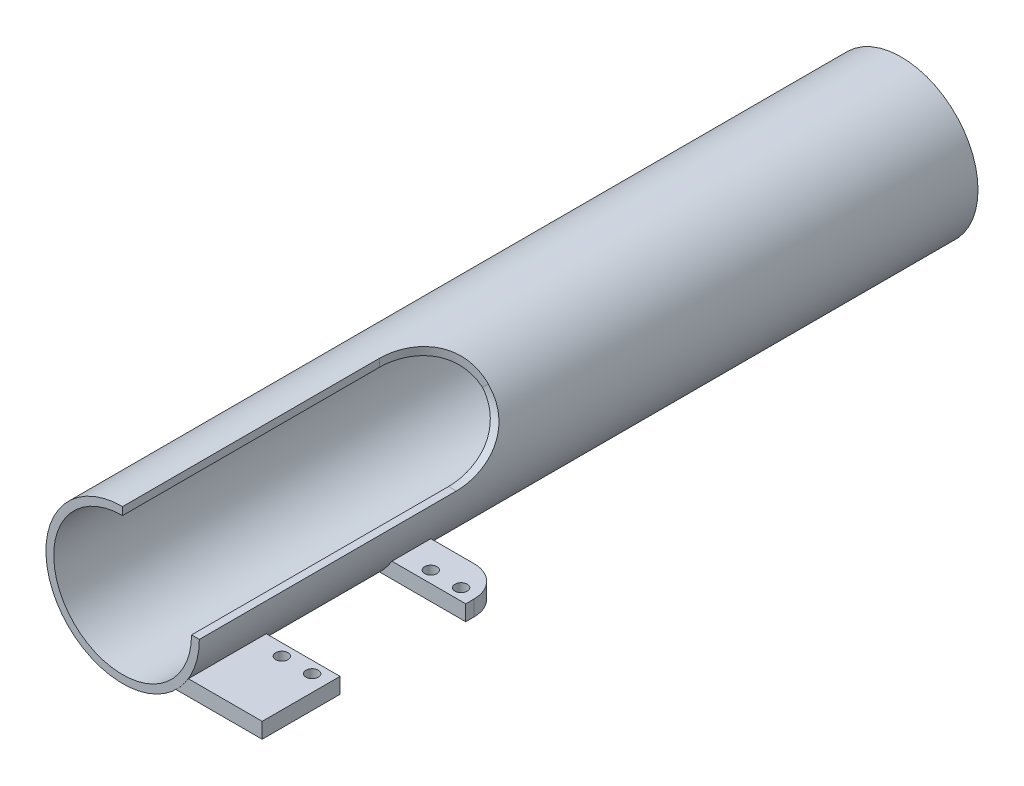
from build123d import *

# Parameters (mm, degrees)
SKETCH1_R                            = 25.019
SKETCH1_R_2                          = 22.479
BOSS_EXTRUDE1_DEPTH                  = 254
CUT_EXTRUDE1_DEPTH                   = 101.6
SKETCH3_W                            = 25.4
SKETCH3_H                            = 5.08
SKETCH3_W_2                          = 12.7
BOSS_EXTRUDE2_DEPTH                  = 20.5
BOSS_EXTRUDE2_DIRECTION_2_REACH      = 262.088
BOSS_EXTRUDE2_DIRECTION_2_END_RADIUS = 25.019
FILLET3_R                            = 17.78
SKETCH4_R                            = 2
CUT_EXTRUDE2_DEPTH                   = 5.08
FILLET4_R                            = 10


with BuildPart() as part:
    # Sketch1 → Boss-Extrude1 (new body)
    with BuildSketch(Plane.XY):
        Circle(SKETCH1_R)
        Circle(SKETCH1_R_2, mode=Mode.SUBTRACT)
    extrude(amount=-BOSS_EXTRUDE1_DEPTH)

    # Sketch2 → Cut-Extrude1 (cut)
    with BuildSketch(Plane.XY):
        with BuildLine():
            Line((0, 22.479), (0, 25.019))
            ThreePointArc((0, 25.019), (17.691104559, 17.691104559), (25.019, 0))
            Line((25.019, 0), (22.479, 0))
            ThreePointArc((22.479, 0), (15.895053334, 15.895053334), (0, 22.479))
        make_face()
    extrude(amount=-CUT_EXTRUDE1_DEPTH, mode=Mode.SUBTRACT)

    # Fillet3
    # the kernel refuses this fillet: 17.78 mm, written as the material it adds along each edge
    with BuildSketch(Plane(origin=(69.469, 0, -101.6), x_dir=(0, 0, 1), z_dir=(-1, 0, 0))) as fillet3_piece_1_section:
        with BuildLine():
            CenterArc((FILLET3_R, FILLET3_R), FILLET3_R, 180, 90)
            Line((0, FILLET3_R), (0, 0))
            Line((0, 0), (FILLET3_R, 0))
        make_face()
    fillet3_piece_1 = extrude(amount=91.44, mode=Mode.PRIVATE)
    fillet3_piece_1 = fillet3_piece_1 & Plane(origin=(0, 0, -97.674052769), x_dir=(1, 0, 0), z_dir=(0, 0, 1)) * Cylinder(25.019, 254, mode=Mode.PRIVATE)
    fillet3_piece_1 = fillet3_piece_1 - Plane(origin=(0, 0, -97.674052769), x_dir=(1, 0, 0), z_dir=(0, 0, 1)) * Cylinder(22.479, 254, mode=Mode.PRIVATE)
    add(fillet3_piece_1)
    with BuildSketch(Plane(origin=(0, -21.971, -101.6), x_dir=(1, 0, 0), z_dir=(0, 1, 0))) as fillet3_piece_2_section:
        with BuildLine():
            CenterArc((FILLET3_R, -FILLET3_R), FILLET3_R, 90, 90)
            Line((0, -FILLET3_R), (0, 0))
            Line((0, 0), (FILLET3_R, 0))
        make_face()
    fillet3_piece_2 = extrude(amount=91.44, mode=Mode.PRIVATE)
    fillet3_piece_2 = fillet3_piece_2 & Plane(origin=(0, 0, -100.962112939), x_dir=(1, 0, 0), z_dir=(0, 0, 1)) * Cylinder(25.019, 254, mode=Mode.PRIVATE)
    fillet3_piece_2 = fillet3_piece_2 - Plane(origin=(0, 0, -100.962112939), x_dir=(1, 0, 0), z_dir=(0, 0, 1)) * Cylinder(22.479, 254, mode=Mode.PRIVATE)
    add(fillet3_piece_2)


with BuildPart() as body_2:
    # Sketch3 → Boss-Extrude2 (new body)
    with BuildSketch(Plane(origin=(25.019, 0, 0), x_dir=(0, 0, -1), z_dir=(1, 0, 0))):
        with Locations((12.7, -15.43)):
            Rectangle(SKETCH3_W, SKETCH3_H)
        with Locations((72.75, -15.43)):
            Rectangle(SKETCH3_W_2, SKETCH3_H)
    extrude(amount=BOSS_EXTRUDE2_DEPTH)

    # Boss-Extrude2 direction 2: up to this cylinder (the profile starts outside it)
    boss_extrude2_direction_2_end = Plane(origin=(0, 0, -42.725), z_dir=(0, 0, 1)) * Cylinder(BOSS_EXTRUDE2_DIRECTION_2_END_RADIUS, 635.264, mode=Mode.PRIVATE)
    # Sketch3 → Boss-Extrude2 direction 2 (add, up to the surface)
    with BuildSketch(Plane(origin=(25.019, 0, 0), x_dir=(0, 0, -1), z_dir=(1, 0, 0)), mode=Mode.PRIVATE) as boss_extrude2_direction_2_sk1:
        with Locations((12.7, -15.43)):
            Rectangle(SKETCH3_W, SKETCH3_H)
    boss_extrude2_direction_2_tool1 = extrude(boss_extrude2_direction_2_sk1.sketch, amount=-BOSS_EXTRUDE2_DIRECTION_2_REACH, mode=Mode.PRIVATE) - boss_extrude2_direction_2_end
    add(boss_extrude2_direction_2_tool1.solids().sort_by_distance((25.019, -15.43, -12.7))[0])
    # Sketch3 → Boss-Extrude2 direction 2 (add, up to the surface)
    with BuildSketch(Plane(origin=(25.019, 0, 0), x_dir=(0, 0, -1), z_dir=(1, 0, 0)), mode=Mode.PRIVATE) as boss_extrude2_direction_2_sk2:
        with Locations((72.75, -15.43)):
            Rectangle(SKETCH3_W_2, SKETCH3_H)
    boss_extrude2_direction_2_tool2 = extrude(boss_extrude2_direction_2_sk2.sketch, amount=-BOSS_EXTRUDE2_DIRECTION_2_REACH, mode=Mode.PRIVATE) - boss_extrude2_direction_2_end
    add(boss_extrude2_direction_2_tool2.solids().sort_by_distance((25.019, -15.43, -72.75))[0])

    # Sketch4 → Cut-Extrude2 (cut)
    with BuildSketch(Plane(origin=(0, -12.89, 0), x_dir=(1, 0, 0), z_dir=(0, 1, 0))):
        with Locations(Location((30.319, 70.2, 0), (0, 0, 270))):
            Circle(SKETCH4_R)
        with Locations(Location((40.219, 70.2, 0), (0, 0, 270))):
            Circle(SKETCH4_R)
        with Locations(Location((30.319, 21.6, 0), (0, 0, 270))):
            Circle(SKETCH4_R)
        with Locations(Location((40.219, 21.6, 0), (0, 0, 270))):
            Circle(SKETCH4_R)
    extrude(amount=-CUT_EXTRUDE2_DEPTH, mode=Mode.SUBTRACT)

    # Fillet4
    fillet4_edges = [body_2.edges().sort_by_distance(p)[0] for p in [
        (45.519, -15.43, -79.1),
    ]]
    fillet(fillet4_edges, radius=FILLET4_R)


solid = Compound([part.part, body_2.part])
